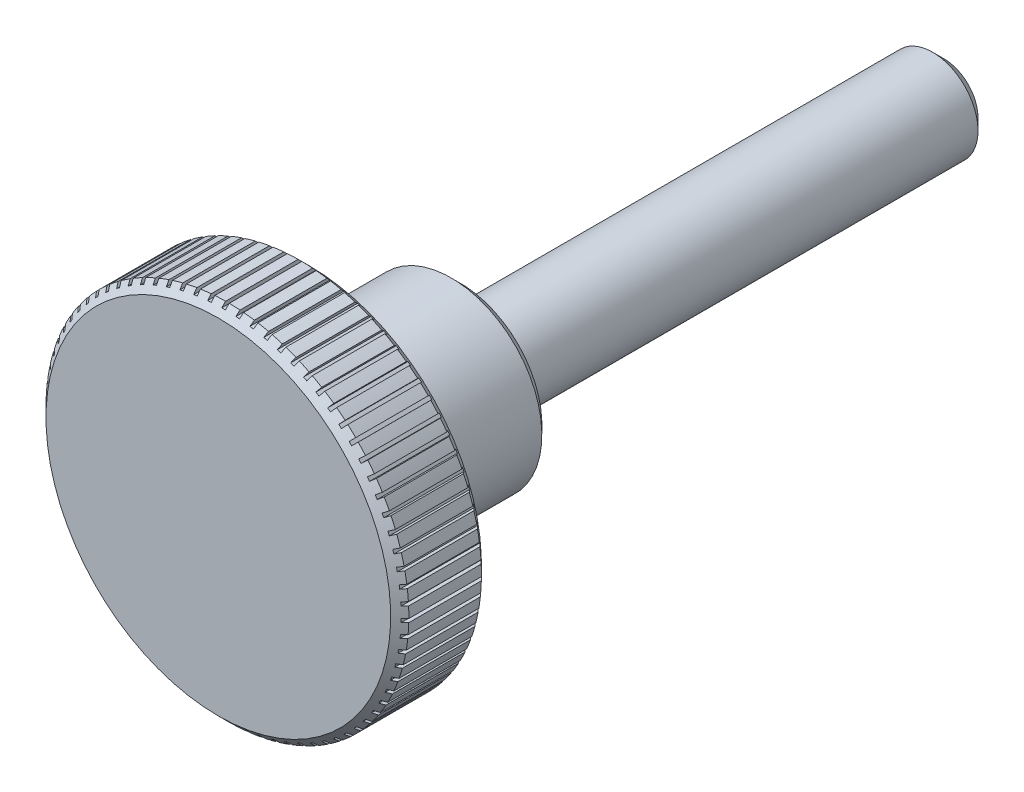
from build123d import *

# Parameters (mm, degrees)
CHAMFER1_SIZE      = 0.3
CHAMFER2_SIZE      = 0.375
FILLET1_R          = 0.3
SKETCH6_W          = 0.12
SKETCH6_H          = 3
CUT_EXTRUDE1_DEPTH = 0.127
CIRPATTERN1_COUNT  = 79


with BuildPart() as part:
    # Sketch2 → Revolve1 (revolve)
    with BuildSketch(Plane(origin=(0, 0, 0), x_dir=(0, 0, -1), z_dir=(1, 0, 0))):
        Polygon((-8, 0), (-8, 6), (-5, 6), (-5, 3), (0, 3), (0, 1.5), (16, 1.5), (16, 0), align=None)
    revolve(axis=Axis((0, 0, 8), (0, 0, -1)))

    # Chamfer1
    chamfer1_edges = [part.edges().sort_by_distance(p)[0] for p in [
        (0, -3, 0),
        (0, -6, 5),
        (0, -6, 8),
    ]]
    chamfer(chamfer1_edges, length=CHAMFER1_SIZE)

    # Chamfer2
    chamfer2_edges = [part.edges().sort_by_distance(p)[0] for p in [
        (0, -1.5, -16),
    ]]
    chamfer(chamfer2_edges, length=CHAMFER2_SIZE)

    # Fillet1
    fillet1_edges = [part.edges().sort_by_distance(p)[0] for p in [
        (0, -3, 5),
    ]]
    fillet(fillet1_edges, radius=FILLET1_R)

    # Sketch6 → Cut-Extrude1 (cut)
    with BuildSketch(Plane(origin=(0, 6, 0), x_dir=(-1, 0, 0), z_dir=(0, 1, 0))):
        with Locations((0, 6.5)):
            Rectangle(SKETCH6_W, SKETCH6_H)
    cut_extrude1 = extrude(amount=-CUT_EXTRUDE1_DEPTH, mode=Mode.SUBTRACT)

    # CirPattern1: Cut-Extrude1 ×79 about axis
    cirpattern1_axis = Axis((0, 0, 5), (0, 0, 1))
    for i in range(1, CIRPATTERN1_COUNT):
        add(cut_extrude1.rotate(cirpattern1_axis, i * 360 / CIRPATTERN1_COUNT), mode=Mode.SUBTRACT)


solid = part.part
